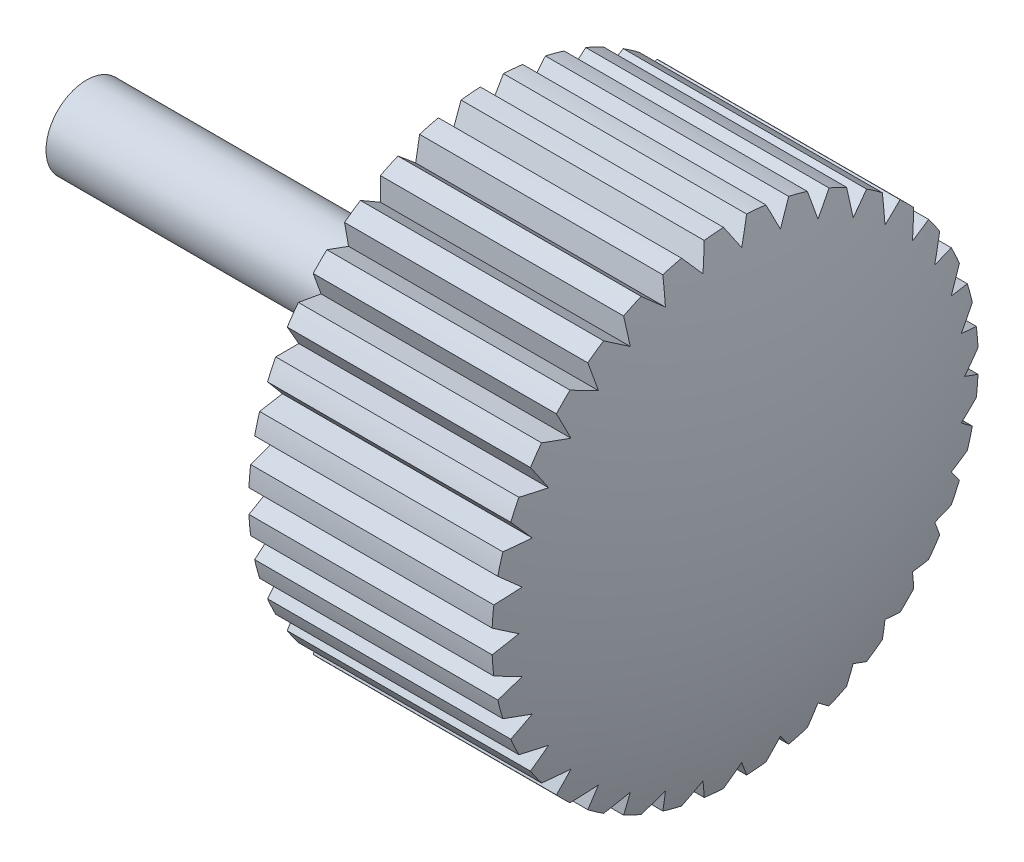
from build123d import *

# Parameters (mm, degrees)
CUT_EXTRUDE1_DEPTH = 22.725560982
CIRPATTERN1_START  = 10
CIRPATTERN1_DEPTH  = 6.163521733


# Read off the part's stored shape, not the designer's step: CirPattern1
with BuildPart() as part:
    # Sketch2 → Revolve1 (revolve)
    with BuildSketch(Plane.XY, mode=Mode.PRIVATE) as revolve1_sk:
        with BuildLine():
            Line((0, 0), (0, 1))
            Line((0, 1), (10, 1))
            Line((10, 1), (10, 6))
            Line((10, 6), (16, 6))
            ThreePointArc((16, 6), (16.748287591, 3.041381265), (17, 0))
            Line((17, 0), (0, 0))
        make_face()
    revolve(revolve1_sk.sketch.rotate(Axis((0, 0, 0), (1, 0, 0)), 90), axis=Axis((0, 0, 0), (1, 0, 0)))

    # Sketch3 → Cut-Extrude1 (cut, through all)
    with BuildSketch(Plane(origin=(20, 0, 0), x_dir=(0, 0, -1), z_dir=(1, 0, 0))):
        with BuildLine():
            Line((0, 5.5), (-0.284771266, 5.9932383))
            ThreePointArc((-0.284771266, 5.9932383), (0, 6), (0.284771266, 5.9932383))
            Line((0.284771266, 5.9932383), (0, 5.5))
        make_face()
    extrude(amount=-CUT_EXTRUDE1_DEPTH, mode=Mode.SUBTRACT)

    # CirPattern1 outline → CirPattern1 (cut)
    with BuildSketch(Plane.YZ.offset(CIRPATTERN1_START)):
        with BuildLine():
            ThreePointArc((-2.75, 5.332682252), (-3, 5.196152423), (-3.2432383, 5.047910986))
            Line((-3.2432383, 5.047910986), (-2.75, 4.763139721))
            Line((-2.75, 4.763139721), (-2.75, 5.332682252))
        make_face()
        with BuildLine():
            Line((5.416442642, -0.955064977), (5.852737532, -1.321159859))
            ThreePointArc((5.852737532, -1.321159859), (5.908846518, -1.041889066), (5.951637555, -0.760269959))
            Line((5.951637555, -0.760269959), (5.416442642, -0.955064977))
        make_face()
        with BuildLine():
            Line((5.168309414, -1.881110788), (5.534404296, -2.317405679))
            ThreePointArc((5.534404296, -2.317405679), (5.638155724, -2.05212086), (5.729199314, -1.782210766))
            Line((5.729199314, -1.782210766), (5.168309414, -1.881110788))
        make_face()
        with BuildLine():
            Line((4.763139721, -2.75), (5.047910986, -3.2432383))
            ThreePointArc((5.047910986, -3.2432383), (5.196152422, -3), (5.332682252, -2.75))
            Line((5.332682252, -2.75), (4.763139721, -2.75))
        make_face()
        with BuildLine():
            Line((4.213244437, -3.535331853), (4.408039455, -4.070526767))
            ThreePointArc((4.408039455, -4.070526767), (4.596266658, -3.856725658), (4.774134337, -3.634231876))
            Line((4.774134337, -3.634231876), (4.213244437, -3.535331853))
        make_face()
        with BuildLine():
            Line((3.535331853, -4.213244437), (3.634231876, -4.774134337))
            ThreePointArc((3.634231876, -4.774134337), (3.856725658, -4.596266658), (4.070526767, -4.408039455))
            Line((4.070526767, -4.408039455), (3.535331853, -4.213244437))
        make_face()
        with BuildLine():
            Line((2.75, -4.763139721), (2.75, -5.332682252))
            ThreePointArc((2.75, -5.332682252), (3, -5.196152422), (3.2432383, -5.047910986))
            Line((3.2432383, -5.047910986), (2.75, -4.763139721))
        make_face()
        with BuildLine():
            Line((1.881110788, -5.168309414), (1.782210766, -5.729199314))
            ThreePointArc((1.782210766, -5.729199314), (2.05212086, -5.638155724), (2.317405679, -5.534404296))
            Line((2.317405679, -5.534404296), (1.881110788, -5.168309414))
        make_face()
        with BuildLine():
            Line((0.955064977, -5.416442642), (0.760269959, -5.951637555))
            ThreePointArc((0.760269959, -5.951637555), (1.041889066, -5.908846518), (1.321159859, -5.852737532))
            Line((1.321159859, -5.852737532), (0.955064977, -5.416442642))
        make_face()
        with BuildLine():
            Line((0, -5.5), (-0.284771266, -5.9932383))
            ThreePointArc((-0.284771266, -5.9932383), (0, -6), (0.284771266, -5.9932383))
            Line((0.284771266, -5.9932383), (0, -5.5))
        make_face()
        with BuildLine():
            Line((-0.955064977, -5.416442642), (-1.321159859, -5.852737533))
            ThreePointArc((-1.321159859, -5.852737533), (-1.041889066, -5.908846518), (-0.760269959, -5.951637555))
            Line((-0.760269959, -5.951637555), (-0.955064977, -5.416442642))
        make_face()
        with BuildLine():
            Line((-1.881110788, -5.168309414), (-2.317405679, -5.534404297))
            ThreePointArc((-2.317405679, -5.534404297), (-2.05212086, -5.638155725), (-1.782210766, -5.729199314))
            Line((-1.782210766, -5.729199314), (-1.881110788, -5.168309414))
        make_face()
        with BuildLine():
            Line((-2.75, -4.763139721), (-3.2432383, -5.047910986))
            ThreePointArc((-3.2432383, -5.047910986), (-3, -5.196152423), (-2.75, -5.332682252))
            Line((-2.75, -5.332682252), (-2.75, -4.763139721))
        make_face()
        with BuildLine():
            Line((-3.535331853, -4.213244437), (-4.070526767, -4.408039455))
            ThreePointArc((-4.070526767, -4.408039455), (-3.856725658, -4.596266658), (-3.634231876, -4.774134337))
            Line((-3.634231876, -4.774134337), (-3.535331853, -4.213244437))
        make_face()
        with BuildLine():
            Line((-4.213244437, -3.535331853), (-4.774134337, -3.634231876))
            ThreePointArc((-4.774134337, -3.634231876), (-4.596266658, -3.856725658), (-4.408039455, -4.070526767))
            Line((-4.408039455, -4.070526767), (-4.213244437, -3.535331853))
        make_face()
        with BuildLine():
            Line((-4.763139721, -2.75), (-5.332682252, -2.75))
            ThreePointArc((-5.332682252, -2.75), (-5.196152423, -3), (-5.047910986, -3.2432383))
            Line((-5.047910986, -3.2432383), (-4.763139721, -2.75))
        make_face()
        with BuildLine():
            Line((-5.168309414, -1.881110788), (-5.729199315, -1.782210766))
            ThreePointArc((-5.729199315, -1.782210766), (-5.638155725, -2.05212086), (-5.534404297, -2.317405679))
            Line((-5.534404297, -2.317405679), (-5.168309414, -1.881110788))
        make_face()
        with BuildLine():
            Line((-5.416442642, -0.955064977), (-5.951637555, -0.760269959))
            ThreePointArc((-5.951637555, -0.760269959), (-5.908846518, -1.041889066), (-5.852737533, -1.321159859))
            Line((-5.852737533, -1.321159859), (-5.416442642, -0.955064977))
        make_face()
        with BuildLine():
            Line((-5.5, 0), (-5.9932383, 0.284771266))
            ThreePointArc((-5.9932383, 0.284771266), (-6, 0), (-5.9932383, -0.284771266))
            Line((-5.9932383, -0.284771266), (-5.5, 0))
        make_face()
        with BuildLine():
            Line((-5.416442642, 0.955064977), (-5.852737533, 1.321159859))
            ThreePointArc((-5.852737533, 1.321159859), (-5.908846518, 1.041889066), (-5.951637555, 0.760269959))
            Line((-5.951637555, 0.760269959), (-5.416442642, 0.955064977))
        make_face()
        with BuildLine():
            Line((-5.168309414, 1.881110788), (-5.534404297, 2.317405679))
            ThreePointArc((-5.534404297, 2.317405679), (-5.638155725, 2.05212086), (-5.729199315, 1.782210766))
            Line((-5.729199315, 1.782210766), (-5.168309414, 1.881110788))
        make_face()
        with BuildLine():
            Line((-4.763139721, 2.75), (-5.047910986, 3.2432383))
            ThreePointArc((-5.047910986, 3.2432383), (-5.196152423, 3), (-5.332682252, 2.75))
            Line((-5.332682252, 2.75), (-4.763139721, 2.75))
        make_face()
        with BuildLine():
            Line((-4.213244437, 3.535331853), (-4.408039455, 4.070526767))
            ThreePointArc((-4.408039455, 4.070526767), (-4.596266658, 3.856725658), (-4.774134337, 3.634231876))
            Line((-4.774134337, 3.634231876), (-4.213244437, 3.535331853))
        make_face()
        with BuildLine():
            Line((-3.535331853, 4.213244437), (-3.634231876, 4.774134337))
            ThreePointArc((-3.634231876, 4.774134337), (-3.856725658, 4.596266658), (-4.070526767, 4.408039455))
            Line((-4.070526767, 4.408039455), (-3.535331853, 4.213244437))
        make_face()
        with BuildLine():
            ThreePointArc((5.951637555, 0.760269959), (5.908846518, 1.041889066), (5.852737532, 1.321159859))
            Line((5.852737532, 1.321159859), (5.416442642, 0.955064977))
            Line((5.416442642, 0.955064977), (5.951637555, 0.760269959))
        make_face()
        with BuildLine():
            ThreePointArc((5.729199314, 1.782210766), (5.638155724, 2.05212086), (5.534404296, 2.317405679))
            Line((5.534404296, 2.317405679), (5.168309414, 1.881110788))
            Line((5.168309414, 1.881110788), (5.729199314, 1.782210766))
        make_face()
        with BuildLine():
            ThreePointArc((5.332682252, 2.75), (5.196152422, 3), (5.047910986, 3.2432383))
            Line((5.047910986, 3.2432383), (4.763139721, 2.75))
            Line((4.763139721, 2.75), (5.332682252, 2.75))
        make_face()
        with BuildLine():
            ThreePointArc((4.774134337, 3.634231876), (4.596266658, 3.856725658), (4.408039455, 4.070526767))
            Line((4.408039455, 4.070526767), (4.213244437, 3.535331853))
            Line((4.213244437, 3.535331853), (4.774134337, 3.634231876))
        make_face()
        with BuildLine():
            ThreePointArc((4.070526767, 4.408039455), (3.856725658, 4.596266658), (3.634231876, 4.774134337))
            Line((3.634231876, 4.774134337), (3.535331853, 4.213244437))
            Line((3.535331853, 4.213244437), (4.070526767, 4.408039455))
        make_face()
        with BuildLine():
            ThreePointArc((3.2432383, 5.047910986), (3, 5.196152422), (2.75, 5.332682252))
            Line((2.75, 5.332682252), (2.75, 4.763139721))
            Line((2.75, 4.763139721), (3.2432383, 5.047910986))
        make_face()
        with BuildLine():
            ThreePointArc((2.317405679, 5.534404296), (2.05212086, 5.638155724), (1.782210766, 5.729199314))
            Line((1.782210766, 5.729199314), (1.881110788, 5.168309414))
            Line((1.881110788, 5.168309414), (2.317405679, 5.534404296))
        make_face()
        with BuildLine():
            ThreePointArc((1.321159859, 5.852737532), (1.041889066, 5.908846518), (0.760269959, 5.951637555))
            Line((0.760269959, 5.951637555), (0.955064977, 5.416442642))
            Line((0.955064977, 5.416442642), (1.321159859, 5.852737532))
        make_face()
        with BuildLine():
            ThreePointArc((0.284771266, 5.9932383), (0, 6), (-0.284771266, 5.9932383))
            Line((-0.284771266, 5.9932383), (0, 5.5))
            Line((0, 5.5), (0.284771266, 5.9932383))
        make_face()
        with BuildLine():
            ThreePointArc((-0.760269959, 5.951637555), (-1.041889066, 5.908846518), (-1.321159859, 5.852737533))
            Line((-1.321159859, 5.852737533), (-0.955064977, 5.416442642))
            Line((-0.955064977, 5.416442642), (-0.760269959, 5.951637555))
        make_face()
        with BuildLine():
            ThreePointArc((-1.782210766, 5.729199314), (-2.05212086, 5.638155725), (-2.317405679, 5.534404297))
            Line((-2.317405679, 5.534404297), (-1.881110788, 5.168309414))
            Line((-1.881110788, 5.168309414), (-1.782210766, 5.729199314))
        make_face()
    extrude(amount=CIRPATTERN1_DEPTH, mode=Mode.SUBTRACT)


solid = part.part
